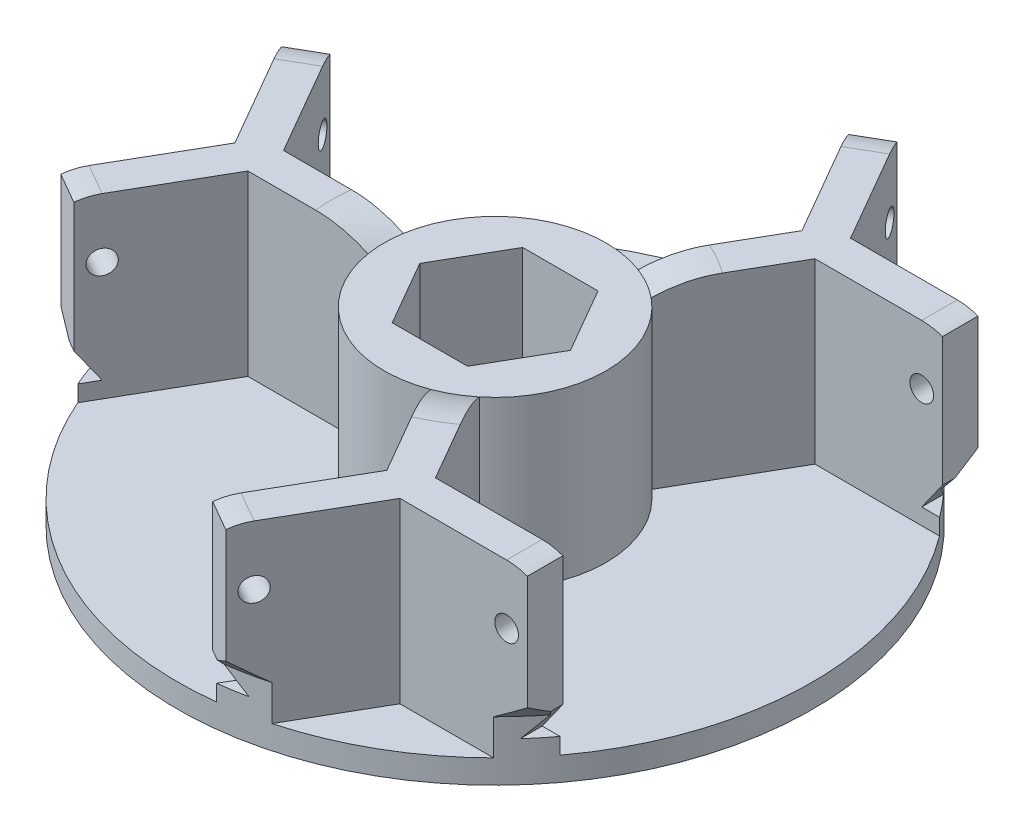
from build123d import *

# Parameters (mm, degrees)
BOSS_EXTRUDE1_DEPTH      = 1
BOSS_EXTRUDE1_DEPTH_BACK = 1
SKETCH2_R                = 30
SKETCH1_R                = 9.350852961
BOSS_EXTRUDE2_DEPTH      = 14
BOSS_EXTRUDE3_DEPTH      = 15
CIRPATTERN1_COUNT        = 3
CUT_EXTRUDE2_DEPTH       = 64.041803276
SKETCH4_R                = 1
CUT_EXTRUDE3_DEPTH       = 43
CIRPATTERN2_COUNT        = 3
CUT_EXTRUDE4_DEPTH       = 43
FILLET1_R                = 10


with BuildPart() as part:
    # Sketch2 → Boss-Extrude1 (new, two sides: drawn at the far end of the back side and taken through both)
    with BuildSketch(Plane(origin=(0, 0, 0), x_dir=(1, 0, 0), z_dir=(0, 1, 0)).offset(-BOSS_EXTRUDE1_DEPTH_BACK)):
        with Locations(Location((0, 0, 0), (0, 0, 270))):
            Circle(SKETCH2_R)
    extrude(amount=BOSS_EXTRUDE1_DEPTH + BOSS_EXTRUDE1_DEPTH_BACK)

    # Sketch1 → Boss-Extrude2 (add)
    with BuildSketch(Plane(origin=(0, 1, 0), x_dir=(1, 0, 0), z_dir=(0, 1, 0))):
        with Locations(Location((0, 0, 0), (0, 0, 90))):
            Circle(SKETCH1_R)
        Polygon((3.175426481, -5.5), (6.350852961, 0), (3.175426481, 5.5), (-3.175426481, 5.5), (-6.350852961, 0), (-3.175426481, -5.5), align=None, mode=Mode.SUBTRACT)
    extrude(amount=BOSS_EXTRUDE2_DEPTH)

    # Sketch1<3> → Boss-Extrude3 (add)
    with BuildSketch(Plane(origin=(0, 1, 0), x_dir=(1, 0, 0), z_dir=(0, 1, 0))):
        with BuildLine():
            Line((2.998219694, 26.806931157), (8.371578903, 17.5))
            Line((8.371578903, 17.5), (3.315841392, 8.74320576))
            ThreePointArc((3.315841392, 8.74320576), (4.675426481, 8.098076211), (5.913917603, 7.24320576))
            Line((5.913917603, 7.24320576), (10.969655115, 16))
            Line((10.969655115, 16), (21.716373532, 16))
            Line((21.716373532, 16), (21.716373532, 19))
            Line((21.716373532, 19), (10.969655115, 19))
            Line((10.969655115, 19), (5.596295906, 28.306931157))
            Line((5.596295906, 28.306931157), (2.998219694, 26.806931157))
        make_face()
    boss_extrude3 = extrude(amount=BOSS_EXTRUDE3_DEPTH)

    # CirPattern1: Boss-Extrude3 ×3 about axis
    cirpattern1_axis = Axis((0, 0, 0), (0, 1, 0))
    for i in range(1, CIRPATTERN1_COUNT):
        add(boss_extrude3.rotate(cirpattern1_axis, i * 360 / CIRPATTERN1_COUNT))

    # Sketch3 → Cut-Extrude2 (cut, symmetric)
    with BuildSketch(Plane(origin=(-16.454482672, 0, 9.5), x_dir=(0.5000000000000041, 0, 0.8660254037844364), z_dir=(-0.8660254037844363, 0, 0.500000000000004))):
        Polygon((-19.969655115, 2.372421116), (-21.716373532, 4.828660441), (-21.716373532, 2.372421116), align=None)
        with BuildLine():
            Line((-21.716373532, 16), (-21.716373532, 15.684973294))
            ThreePointArc((-21.716373532, 15.684973294), (-20.857104699, 15.920613096), (-19.969655115, 16))
            Line((-19.969655115, 16), (-21.716373532, 16))
        make_face()
    cut_extrude2 = extrude(amount=CUT_EXTRUDE2_DEPTH, both=True, mode=Mode.SUBTRACT)

    # Sketch4 → Cut-Extrude3 (cut)
    with BuildSketch(Plane(origin=(-16.454482672, 0, 9.5), x_dir=(0.500000000000004, 0, 0.8660254037844364), z_dir=(-0.8660254037844365, 0, 0.500000000000004))):
        with Locations((-19.969655115, 11)):
            Circle(SKETCH4_R)
    cut_extrude3 = extrude(amount=-CUT_EXTRUDE3_DEPTH, mode=Mode.SUBTRACT)

    # CirPattern2: Cut-Extrude2, Cut-Extrude3 ×3 about axis
    cirpattern2_axis = Axis((0, 1, 0), (0, 1, 0))
    add([cut_extrude2.rotate(cirpattern2_axis, i * 360 / CIRPATTERN2_COUNT) for i in range(1, CIRPATTERN2_COUNT)], mode=Mode.SUBTRACT)
    add([cut_extrude3.rotate(cirpattern2_axis, i * 360 / CIRPATTERN2_COUNT) for i in range(1, CIRPATTERN2_COUNT)], mode=Mode.SUBTRACT)

    # Sketch5 → Cut-Revolve2 (revolve, cut)
    with BuildSketch(Plane(origin=(0, 0, 0), x_dir=(0, 0, -1), z_dir=(1, 0, 0)), mode=Mode.PRIVATE) as cut_revolve2_sk:
        Polygon((-26.777856991, 4), (-31.777856991, 9), (-31.777856991, -1), (-26.777856991, -1), align=None)
    revolve(cut_revolve2_sk.sketch.rotate(Axis((0, -1000, 0), (0, 1, 0)), 180), axis=Axis((0, -1000, 0), (0, 1, 0)), mode=Mode.SUBTRACT)

    # Sketch1<4> → Cut-Extrude4 (cut)
    with BuildSketch(Plane(origin=(0, 1, 0), x_dir=(1, 0, 0), z_dir=(0, 1, 0))):
        Polygon((-3.175426481, -5.5), (3.175426481, -5.5), (6.350852961, 0), (3.175426481, 5.5), (-3.175426481, 5.5), (-6.350852961, 0), align=None)
    extrude(amount=-CUT_EXTRUDE4_DEPTH, mode=Mode.SUBTRACT)

    # Fillet1
    # the kernel refuses this fillet: 10 mm, written as the material it takes off along each edge
    with BuildSketch(Plane(origin=(0, 16, 0), x_dir=(0.9612469799967569, 0, -0.27568867123462737), z_dir=(-0.27568867123462737, 0, -0.9612469799967569))) as fillet1_piece_1:
        with BuildLine():
            CenterArc((13.709751905, 10), FILLET1_R, 244.158067237, 25.841932763)
            Line((9.350852961, 1), (9.263674982, 0.82))
            ThreePointArc((9.263674982, 0.82), (9.150852961, 0.5), (9.150852961, 0))
            Line((9.150852961, 0), (9.350852961, -0.2))
            Line((9.350852961, -0.2), (13.709751905, -0.2))
            Line((13.709751905, -0.2), (13.709751905, 0))
        make_face()
    revolve(axis=Axis((0, 16, 0), (0, -1, 0)), revolution_arc=152.006117334, mode=Mode.SUBTRACT)
    with BuildSketch(Plane(origin=(0, 16, 0), x_dir=(-0.24187009717361344, 0, 0.9703086396055776), z_dir=(0.9703086396055776, 0, 0.24187009717361344))) as fillet1_piece_2:
        with BuildLine():
            CenterArc((13.709751905, 10), FILLET1_R, 244.158067237, 25.841932763)
            Line((9.350852961, 1), (9.263674982, 0.82))
            ThreePointArc((9.263674982, 0.82), (9.150852961, 0.5), (9.150852961, 0))
            Line((9.150852961, 0), (9.350852961, -0.2))
            Line((9.350852961, -0.2), (13.709751905, -0.2))
            Line((13.709751905, -0.2), (13.709751905, 0))
        make_face()
    revolve(axis=Axis((0, 16, 0), (0, -1, 0)), revolution_arc=152.006117334, mode=Mode.SUBTRACT)
    with BuildSketch(Plane(origin=(0, 16, 0), x_dir=(-0.7193768828231427, 0, -0.6946199683709492), z_dir=(-0.6946199683709492, 0, 0.7193768828231427))) as fillet1_piece_3:
        with BuildLine():
            CenterArc((13.709751905, 10), FILLET1_R, 244.158067237, 25.841932763)
            Line((13.709751905, 0), (13.709751905, -0.2))
            Line((13.709751905, -0.2), (9.350852961, -0.2))
            Line((9.350852961, -0.2), (9.150852961, 0))
            ThreePointArc((9.150852961, 0), (9.150852961, 0.5), (9.263674982, 0.82))
            Line((9.263674982, 0.82), (9.350852961, 1))
        make_face()
    revolve(axis=Axis((0, 16, 0), (0, -1, 0)), revolution_arc=152.006117334, mode=Mode.SUBTRACT)


solid = part.part
